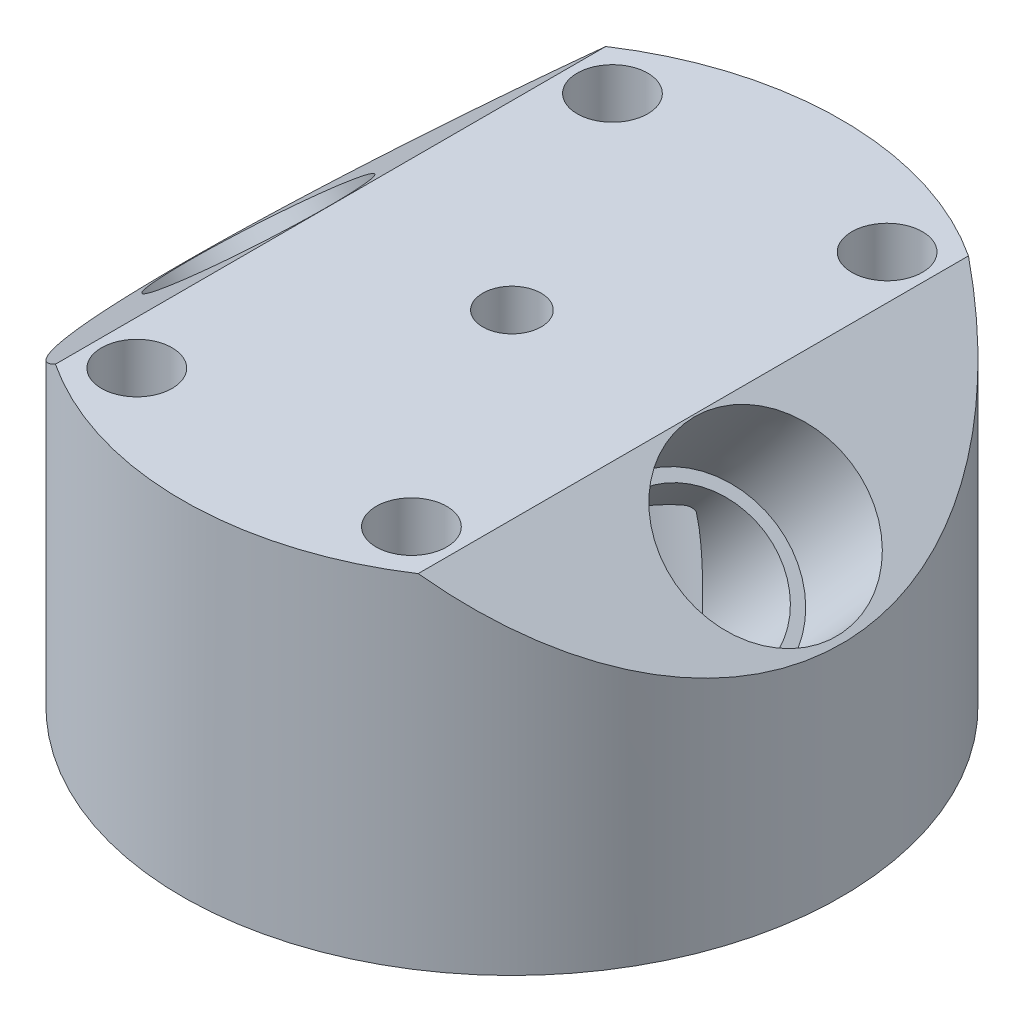
from build123d import *

# Parameters (mm, degrees)
CUT_EXTRUDE1_DEPTH         = 58.529738397
CUT_EXTRUDE1_DEPTH_BACK    = 58.529738397
F_1_4_28_TAPPED_HOLE1_D    = 5.4102
CUT_EXTRUDE2_START         = -6.35
SKETCH5_R                  = 30.48
CUT_EXTRUDE2_DEPTH         = 6.35
USE_ROUND_CORNER_ENDMILL_R = 0.762
F_1_4_CLEARANCE_HOLE1_D    = 6.5278


with BuildPart() as part:
    # MASTER → MASTER_SKETCH (revolve)
    with BuildSketch(Plane.XY):
        Polygon((0, 38.1), (-30.48, 38.1), (-30.48, 0), (-12.7, 0), (-12.7, 19.05), (-6.3246, 19.05), (-4.7625, 17.4879), (0, 17.4879), align=None)
    revolve(axis=Axis((0, 38.1, 0), (0, -1, 0)))

    # Sketch2 → Cut-Extrude1 (cut, two sides: drawn at the far end of the back side and taken through both)
    with BuildSketch(Plane.XY.offset(-CUT_EXTRUDE1_DEPTH_BACK)):
        Polygon((-30.48, 20.248277745), (-9.205145869, 38.1), (-30.48, 38.1), align=None)
        Polygon((30.48, 38.1), (9.205145869, 38.1), (30.48, 20.248277745), align=None)
    extrude(amount=CUT_EXTRUDE1_DEPTH + CUT_EXTRUDE1_DEPTH_BACK, mode=Mode.SUBTRACT)

    # 1/4-28 Tapped Hole1 (through all)
    with Locations(Plane(origin=(0, 38.1, 0), x_dir=(1, 0, 0), z_dir=(0, 1, 0))):
        with Locations((0, 0)):
            Hole(F_1_4_28_TAPPED_HOLE1_D / 2)

    # Sketch5 → Cut-Extrude2 (cut)
    with BuildSketch(Plane(origin=(0, 38.1, 0), x_dir=(1, 0, 0), z_dir=(0, 1, 0)).offset(CUT_EXTRUDE2_START)):
        Circle(SKETCH5_R)
    extrude(amount=CUT_EXTRUDE2_DEPTH, mode=Mode.SUBTRACT)

    # use-round-corner-endmill
    use_round_corner_endmill_edges = [part.edges().sort_by_distance(p)[0] for p in [
        (6.3246, 19.05, 0),
        (12.7, 19.05, 0),
    ]]
    fillet(use_round_corner_endmill_edges, radius=USE_ROUND_CORNER_ENDMILL_R)

    # Sketch7 → 3/8 NPT Tapped Hole1 (revolve, cut)
    with BuildSketch(Plane(origin=(-23.455832083, 26.142254454, 0), x_dir=(-0.7660444431189741, -0.642787609686544, 0), z_dir=(0, 0, 1))):
        Polygon((0, 0), (0, 54.695413336), (7.1374, 54.695413336), (7.1374, 10.414), (8.263205494, 10.414), (8.5750146, 0), align=None)
    f_3_8_npt_tapped_hole1 = revolve(axis=Axis((-27.537533405, 31.006636667, 0), (0.6427876096865441, -0.7660444431189741, 0)), mode=Mode.SUBTRACT)

    # Mirror1: 3/8 NPT Tapped Hole1 across plane
    add(f_3_8_npt_tapped_hole1.mirror(Plane(origin=(0, 0, 0), x_dir=(0, 0, 1), z_dir=(1, 0, 0))), mode=Mode.SUBTRACT)

    # 1/4 Clearance Hole1 (through all)
    with Locations(Plane(origin=(0, 31.75, 0), x_dir=(1, 0, 0), z_dir=(0, 1, 0))):
        with Locations((-12.7, -21.997045256), (12.7, -21.997045256), (12.7, 21.997045256), (-12.7, 21.997045256)):
            Hole(F_1_4_CLEARANCE_HOLE1_D / 2)


solid = part.part
